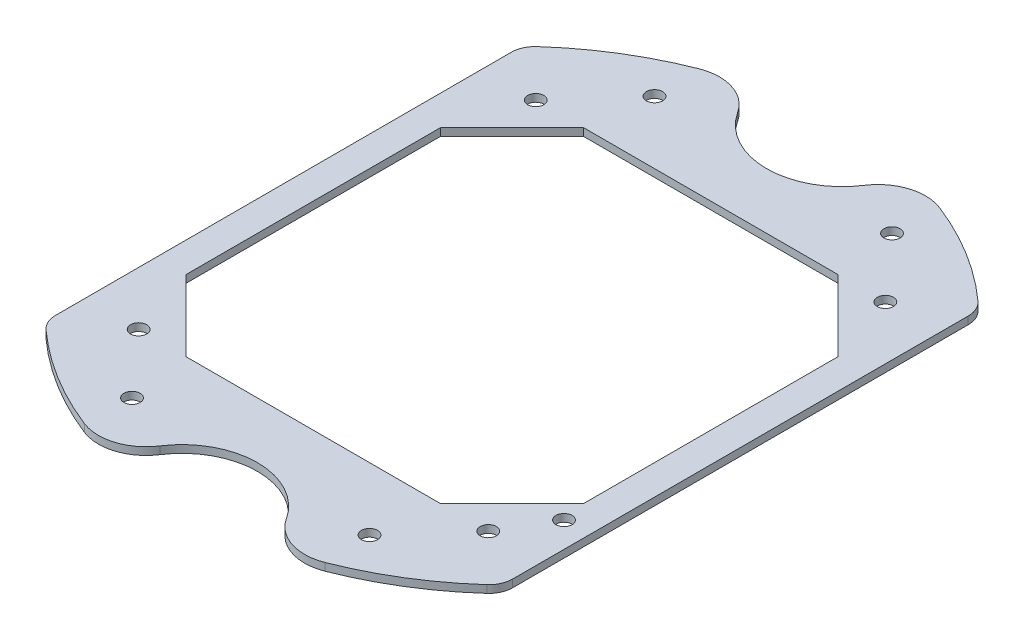
from build123d import *

# Parameters (mm, degrees)
BOSS_EXTRUDE1_DEPTH                     = 1.6
ENCLOSURE_MOUNTING_HOLES_M3_CLEARANCE_D = 3.4
BULKHEAD_MOUNTING_HOLES_M4X0_7_TAPPED_D = 3.4
SKETCH14_R                              = 1.7
CUT_EXTRUDE1_DEPTH                      = 82.171141516
CUT_EXTRUDE3_DEPTH                      = 10


with BuildPart() as part:
    # Sketch1 → Boss-Extrude1 (new body)
    with BuildSketch(Plane(origin=(0, 0, 0), x_dir=(1, 0, 0), z_dir=(0, 1, 0))):
        with BuildLine():
            Line((-48.093300583, -47.950176286), (-48.093300583, 47.950176286))
            ThreePointArc((-48.093300583, 47.950176286), (-47.660075225, 49.985997832), (-46.435472835, 51.669031572))
            ThreePointArc((-46.435472835, 51.669031572), (-36.474980605, 59.122903776), (-25.344708101, 64.680659646))
            ThreePointArc((-25.344708101, 64.680659646), (-18.640624701, 64.891621686), (-13.31129345, 60.818850193))
            ThreePointArc((-13.31129345, 60.818850193), (0, 53.594), (13.31129345, 60.818850193))
            ThreePointArc((13.31129345, 60.818850193), (18.640624701, 64.891621686), (25.344708101, 64.680659646))
            ThreePointArc((25.344708101, 64.680659646), (36.474980605, 59.122903776), (46.435472835, 51.669031572))
            ThreePointArc((46.435472835, 51.669031572), (47.660075225, 49.985997832), (48.093300583, 47.950176286))
            Line((48.093300583, 47.950176286), (48.093300583, -47.950176286))
            ThreePointArc((48.093300583, -47.950176286), (47.660075225, -49.985997832), (46.435472835, -51.669031572))
            ThreePointArc((46.435472835, -51.669031572), (36.474980605, -59.122903776), (25.344708101, -64.680659646))
            ThreePointArc((25.344708101, -64.680659646), (18.640624701, -64.891621686), (13.31129345, -60.818850193))
            ThreePointArc((13.31129345, -60.818850193), (0, -53.594), (-13.31129345, -60.818850193))
            ThreePointArc((-13.31129345, -60.818850193), (-18.640624701, -64.891621686), (-25.344708101, -64.680659646))
            ThreePointArc((-25.344708101, -64.680659646), (-36.474980605, -59.122903776), (-46.435472835, -51.669031572))
            ThreePointArc((-46.435472835, -51.669031572), (-47.660075225, -49.985997832), (-48.093300583, -47.950176286))
        make_face()
    extrude(amount=-BOSS_EXTRUDE1_DEPTH)

    # Enclosure Mounting Holes - M3 Clearance Hole1 (through all)
    with Locations(Plane(origin=(0, 0, 0), x_dir=(1, 0, 0), z_dir=(0, 1, 0))):
        with Locations((-36.8, 41.8), (-36.8, -41.8), (36.8, -41.8), (36.8, 41.8)):
            Hole(ENCLOSURE_MOUNTING_HOLES_M3_CLEARANCE_D / 2)

    # Bulkhead Mounting Holes - M4x0.7 Tapped Hole1 (through all)
    with Locations(Plane(origin=(0, 0, 0), x_dir=(1, 0, 0), z_dir=(0, 1, 0))):
        with Locations((-25, 55), (25, 55), (25, -55), (-25, -55)):
            Hole(BULKHEAD_MOUNTING_HOLES_M4X0_7_TAPPED_D / 2)

    # Sketch14 → Cut-Extrude1 (cut, through all)
    with BuildSketch(Plane(origin=(0, 0, 0), x_dir=(1, 0, 0), z_dir=(0, 1, 0))):
        with Locations((42.75, -31.8)):
            Circle(SKETCH14_R)
    extrude(amount=-CUT_EXTRUDE1_DEPTH, mode=Mode.SUBTRACT)

    # Sketch17 → Cut-Extrude3 (cut)
    with BuildSketch(Plane(origin=(0, 0, 0), x_dir=(1, 0, 0), z_dir=(0, 1, 0))):
        Polygon((-26.8, -41.8), (26.8, -41.8), (41.8, -26.8), (41.8, 26.8), (26.8, 41.8), (-26.8, 41.8), (-41.8, 26.8), (-41.8, -26.8), align=None)
    extrude(amount=-CUT_EXTRUDE3_DEPTH, mode=Mode.SUBTRACT)


solid = part.part
